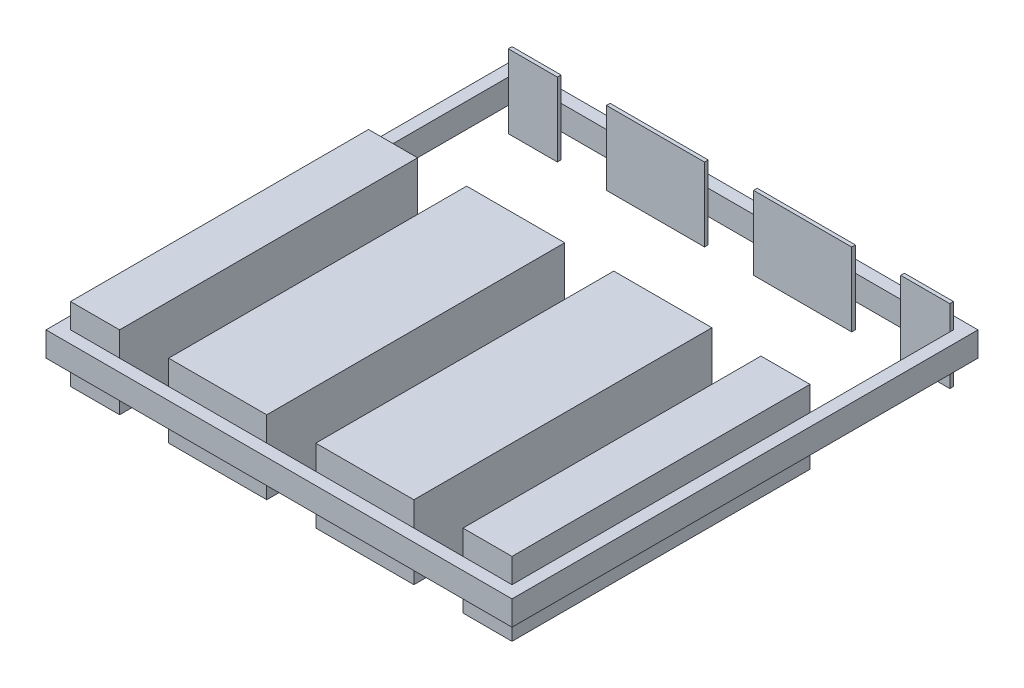
from build123d import *

# Parameters (mm, degrees)
SKETCH1_W           = 180
SKETCH1_H           = 30
BOSS_EXTRUDE1_DEPTH = 90
SKETCH2_W           = 20
SKETCH2_H           = 30
CUT_EXTRUDE1_DEPTH  = 90
CUT_EXTRUDE2_START  = -31.5
SKETCH3_OUTSIDE_W   = 233.264
SKETCH3_OUTSIDE_H   = 83.264
SKETCH3_OUTSIDE_W_2 = 17
SKETCH3_OUTSIDE_H_2 = 27
CUT_EXTRUDE2_DEPTH  = 57
SKETCH4_W           = 17
SKETCH4_H           = 27
CUT_EXTRUDE3_DEPTH  = 28.5
CUT_EXTRUDE4_START  = 31.5
SKETCH5_W           = 17
SKETCH5_H           = 27
CUT_EXTRUDE4_DEPTH  = 57
BOSS_EXTRUDE2_START = -31.5
SKETCH6_W           = 1.5
SKETCH6_H           = 25
BOSS_EXTRUDE2_DEPTH = 57
SKETCH7_W           = 1.5
SKETCH7_H           = 25
BOSS_EXTRUDE3_DEPTH = 28.5
BOSS_EXTRUDE4_START = 31.5
SKETCH8_W           = 1.5
SKETCH8_H           = 25
BOSS_EXTRUDE4_DEPTH = 57
CUT_EXTRUDE5_START  = -31.5
SKETCH9_OUTSIDE_W   = 233.264
SKETCH9_OUTSIDE_H   = 83.264
SKETCH9_OUTSIDE_W_2 = 1.5
SKETCH9_OUTSIDE_H_2 = 2
SKETCH9_OUTSIDE_H_3 = 1
SKETCH9_OUTSIDE_H_4 = 0.5
SKETCH9_OUTSIDE_H_5 = 0.25
CUT_EXTRUDE5_DEPTH  = 57
SKETCH10_W          = 1.5
SKETCH10_H          = 2
SKETCH10_H_2        = 1
SKETCH10_H_3        = 0.5
SKETCH10_H_4        = 0.25
CUT_EXTRUDE6_DEPTH  = 28.5
CUT_EXTRUDE7_START  = 31.5
SKETCH11_W          = 1.5
SKETCH11_H          = 2
SKETCH11_H_2        = 1
SKETCH11_H_3        = 0.5
SKETCH11_H_4        = 0.25
CUT_EXTRUDE7_DEPTH  = 57
SKETCH12_W          = 190
SKETCH12_H          = 190
SKETCH12_W_2        = 180
SKETCH12_H_2        = 180
BOSS_EXTRUDE5_DEPTH = 5


with BuildPart() as part:
    # Sketch1 → Boss-Extrude1 (new, symmetric)
    with BuildSketch(Plane.XY):
        Rectangle(SKETCH1_W, SKETCH1_H)
    extrude(amount=BOSS_EXTRUDE1_DEPTH, both=True)

    # Sketch2 → Cut-Extrude1 (cut, symmetric)
    with BuildSketch(Plane.XY):
        with Locations((-60, 0)):
            Rectangle(SKETCH2_W, SKETCH2_H)
        Rectangle(SKETCH2_W, SKETCH2_H)
        with Locations((60, 0)):
            Rectangle(SKETCH2_W, SKETCH2_H)
    extrude(amount=CUT_EXTRUDE1_DEPTH, both=True, mode=Mode.SUBTRACT)


with BuildPart() as cut_extrude1_piece_1:
    # of the separate pieces the step leaves, piece 1, a body of its own (cut_extrude1_pieces)
    add(part.part.solids().sort_by_distance((-50, -15, -90))[0])


with BuildPart() as cut_extrude1_piece_2:
    # of the separate pieces the step leaves, piece 2, a body of its own (cut_extrude1_pieces)
    add(part.part.solids().sort_by_distance((10, -15, -90))[0])


with BuildPart() as cut_extrude1_piece_3:
    # of the separate pieces the step leaves, piece 3, a body of its own (cut_extrude1_pieces)
    add(part.part.solids().sort_by_distance((-90, -15, 90))[0])


with BuildPart() as cut_extrude1_piece_4:
    # of the separate pieces the step leaves, piece 4, a body of its own (cut_extrude1_pieces)
    add(part.part.solids().sort_by_distance((70, -15, -90))[0])


with BuildPart() as cut_extrude2_tool:
    # Sketch3 outside → Cut-Extrude2 (new body)
    with BuildSketch(Plane.XY.offset(CUT_EXTRUDE2_START)):
        Rectangle(SKETCH3_OUTSIDE_W, SKETCH3_OUTSIDE_H)
        with Locations((-80, 0)):
            Rectangle(SKETCH3_OUTSIDE_W_2, SKETCH3_OUTSIDE_H_2, mode=Mode.SUBTRACT)
        with Locations((-40, 0)):
            Rectangle(SKETCH3_OUTSIDE_W_2, SKETCH3_OUTSIDE_H_2, mode=Mode.SUBTRACT)
        with Locations((-20, 0)):
            Rectangle(SKETCH3_OUTSIDE_W_2, SKETCH3_OUTSIDE_H_2, mode=Mode.SUBTRACT)
        with Locations((20, 0)):
            Rectangle(SKETCH3_OUTSIDE_W_2, SKETCH3_OUTSIDE_H_2, mode=Mode.SUBTRACT)
        with Locations((40, 0)):
            Rectangle(SKETCH3_OUTSIDE_W_2, SKETCH3_OUTSIDE_H_2, mode=Mode.SUBTRACT)
        with Locations((80, 0)):
            Rectangle(SKETCH3_OUTSIDE_W_2, SKETCH3_OUTSIDE_H_2, mode=Mode.SUBTRACT)
    extrude(amount=-CUT_EXTRUDE2_DEPTH)


with BuildPart() as cut_extrude1_piece_1_1:
    add(cut_extrude1_piece_1.part)

    # Cut-Extrude2: cut by cut_extrude2_tool
    add(cut_extrude2_tool.part, mode=Mode.SUBTRACT)


with BuildPart() as cut_extrude1_piece_2_1:
    add(cut_extrude1_piece_2.part)

    # Cut-Extrude2: cut by cut_extrude2_tool
    add(cut_extrude2_tool.part, mode=Mode.SUBTRACT)


with BuildPart() as cut_extrude1_piece_3_1:
    add(cut_extrude1_piece_3.part)

    # Cut-Extrude2: cut by cut_extrude2_tool
    add(cut_extrude2_tool.part, mode=Mode.SUBTRACT)


with BuildPart() as cut_extrude1_piece_4_1:
    add(cut_extrude1_piece_4.part)

    # Cut-Extrude2: cut by cut_extrude2_tool
    add(cut_extrude2_tool.part, mode=Mode.SUBTRACT)


with BuildPart() as cut_extrude3_tool:
    # Sketch4 → Cut-Extrude3 (new, symmetric)
    with BuildSketch(Plane.XY):
        with Locations((-80, 0)):
            Rectangle(SKETCH4_W, SKETCH4_H)
        with Locations((-40, 0)):
            Rectangle(SKETCH4_W, SKETCH4_H)
        with Locations((-20, 0)):
            Rectangle(SKETCH4_W, SKETCH4_H)
        with Locations((20, 0)):
            Rectangle(SKETCH4_W, SKETCH4_H)
        with Locations((40, 0)):
            Rectangle(SKETCH4_W, SKETCH4_H)
        with Locations((80, 0)):
            Rectangle(SKETCH4_W, SKETCH4_H)
    extrude(amount=CUT_EXTRUDE3_DEPTH, both=True)


with BuildPart() as cut_extrude1_piece_1_2:
    add(cut_extrude1_piece_1_1.part)

    # Cut-Extrude3: cut by cut_extrude3_tool
    add(cut_extrude3_tool.part, mode=Mode.SUBTRACT)


with BuildPart() as cut_extrude1_piece_2_2:
    add(cut_extrude1_piece_2_1.part)

    # Cut-Extrude3: cut by cut_extrude3_tool
    add(cut_extrude3_tool.part, mode=Mode.SUBTRACT)


with BuildPart() as cut_extrude1_piece_3_2:
    add(cut_extrude1_piece_3_1.part)

    # Cut-Extrude3: cut by cut_extrude3_tool
    add(cut_extrude3_tool.part, mode=Mode.SUBTRACT)


with BuildPart() as cut_extrude1_piece_4_2:
    add(cut_extrude1_piece_4_1.part)

    # Cut-Extrude3: cut by cut_extrude3_tool
    add(cut_extrude3_tool.part, mode=Mode.SUBTRACT)


with BuildPart() as cut_extrude4_tool:
    # Sketch5 → Cut-Extrude4 (new body)
    with BuildSketch(Plane.XY.offset(CUT_EXTRUDE4_START)):
        with Locations((-80, 0)):
            Rectangle(SKETCH5_W, SKETCH5_H)
        with Locations((-40, 0)):
            Rectangle(SKETCH5_W, SKETCH5_H)
        with Locations((-20, 0)):
            Rectangle(SKETCH5_W, SKETCH5_H)
        with Locations((20, 0)):
            Rectangle(SKETCH5_W, SKETCH5_H)
        with Locations((40, 0)):
            Rectangle(SKETCH5_W, SKETCH5_H)
        with Locations((80, 0)):
            Rectangle(SKETCH5_W, SKETCH5_H)
    extrude(amount=-CUT_EXTRUDE4_DEPTH)


with BuildPart() as cut_extrude1_piece_1_3:
    add(cut_extrude1_piece_1_2.part)

    # Cut-Extrude4: cut by cut_extrude4_tool
    add(cut_extrude4_tool.part, mode=Mode.SUBTRACT)



with BuildPart() as cut_extrude1_piece_2_3:
    add(cut_extrude1_piece_2_2.part)

    # Cut-Extrude4: cut by cut_extrude4_tool
    add(cut_extrude4_tool.part, mode=Mode.SUBTRACT)


with BuildPart() as cut_extrude1_piece_3_3:
    add(cut_extrude1_piece_3_2.part)

    # Cut-Extrude4: cut by cut_extrude4_tool
    add(cut_extrude4_tool.part, mode=Mode.SUBTRACT)


with BuildPart() as cut_extrude1_piece_4_3:
    add(cut_extrude1_piece_4_2.part)

    # Cut-Extrude4: cut by cut_extrude4_tool
    add(cut_extrude4_tool.part, mode=Mode.SUBTRACT)


with BuildPart() as cut_extrude1_piece_1_4:
    add(cut_extrude1_piece_1_3.part)

    add(cut_extrude1_piece_2_3.part)  # Boss-Extrude2 merges Cut-Extrude1 piece 2

    add(cut_extrude1_piece_3_3.part)  # Boss-Extrude2 merges Cut-Extrude1 piece 3

    add(cut_extrude1_piece_4_3.part)  # Boss-Extrude2 merges Cut-Extrude1 piece 4
    # Sketch6 → Boss-Extrude2 (add)
    with BuildSketch(Plane.XY.offset(BOSS_EXTRUDE2_START)):
        with Locations((-75.375, -1)):
            Rectangle(SKETCH6_W, SKETCH6_H)
        with Locations((-80, 1)):
            Rectangle(SKETCH6_W, SKETCH6_H)
        with Locations((-84.625, -1)):
            Rectangle(SKETCH6_W, SKETCH6_H)
        with Locations((-44.625, -1)):
            Rectangle(SKETCH6_W, SKETCH6_H)
        with Locations((-40, 1)):
            Rectangle(SKETCH6_W, SKETCH6_H)
        with Locations((-35.375, -1)):
            Rectangle(SKETCH6_W, SKETCH6_H)
        with Locations((-15.375, -1)):
            Rectangle(SKETCH6_W, SKETCH6_H)
        with Locations((-20, 1)):
            Rectangle(SKETCH6_W, SKETCH6_H)
        with Locations((-24.625, -1)):
            Rectangle(SKETCH6_W, SKETCH6_H)
        with Locations((15.375, -1)):
            Rectangle(SKETCH6_W, SKETCH6_H)
        with Locations((20, 1)):
            Rectangle(SKETCH6_W, SKETCH6_H)
        with Locations((24.625, -1)):
            Rectangle(SKETCH6_W, SKETCH6_H)
        with Locations((44.625, -1)):
            Rectangle(SKETCH6_W, SKETCH6_H)
        with Locations((40, 1)):
            Rectangle(SKETCH6_W, SKETCH6_H)
        with Locations((35.375, -1)):
            Rectangle(SKETCH6_W, SKETCH6_H)
        with Locations((75.375, -1)):
            Rectangle(SKETCH6_W, SKETCH6_H)
        with Locations((80, 1)):
            Rectangle(SKETCH6_W, SKETCH6_H)
        with Locations((84.625, -1)):
            Rectangle(SKETCH6_W, SKETCH6_H)
    extrude(amount=BOSS_EXTRUDE2_DEPTH)

    # Sketch7 → Boss-Extrude3 (add, symmetric)
    with BuildSketch(Plane.XY):
        with Locations((-75.375, -1)):
            Rectangle(SKETCH7_W, SKETCH7_H)
        with Locations((-80, 1)):
            Rectangle(SKETCH7_W, SKETCH7_H)
        with Locations((-84.625, -1)):
            Rectangle(SKETCH7_W, SKETCH7_H)
        with Locations((-44.625, -1)):
            Rectangle(SKETCH7_W, SKETCH7_H)
        with Locations((-40, 1)):
            Rectangle(SKETCH7_W, SKETCH7_H)
        with Locations((-35.375, -1)):
            Rectangle(SKETCH7_W, SKETCH7_H)
        with Locations((-15.375, -1)):
            Rectangle(SKETCH7_W, SKETCH7_H)
        with Locations((-20, 1)):
            Rectangle(SKETCH7_W, SKETCH7_H)
        with Locations((-24.625, -1)):
            Rectangle(SKETCH7_W, SKETCH7_H)
        with Locations((15.375, -1)):
            Rectangle(SKETCH7_W, SKETCH7_H)
        with Locations((20, 1)):
            Rectangle(SKETCH7_W, SKETCH7_H)
        with Locations((24.625, -1)):
            Rectangle(SKETCH7_W, SKETCH7_H)
        with Locations((44.625, -1)):
            Rectangle(SKETCH7_W, SKETCH7_H)
        with Locations((40, 1)):
            Rectangle(SKETCH7_W, SKETCH7_H)
        with Locations((35.375, -1)):
            Rectangle(SKETCH7_W, SKETCH7_H)
        with Locations((75.375, -1)):
            Rectangle(SKETCH7_W, SKETCH7_H)
        with Locations((80, 1)):
            Rectangle(SKETCH7_W, SKETCH7_H)
        with Locations((84.625, -1)):
            Rectangle(SKETCH7_W, SKETCH7_H)
    extrude(amount=BOSS_EXTRUDE3_DEPTH, both=True)

    # Sketch8 → Boss-Extrude4 (add)
    with BuildSketch(Plane.XY.offset(BOSS_EXTRUDE4_START)):
        with Locations((-75.375, -1)):
            Rectangle(SKETCH8_W, SKETCH8_H)
        with Locations((-80, 1)):
            Rectangle(SKETCH8_W, SKETCH8_H)
        with Locations((-84.625, -1)):
            Rectangle(SKETCH8_W, SKETCH8_H)
        with Locations((-44.625, -1)):
            Rectangle(SKETCH8_W, SKETCH8_H)
        with Locations((-40, 1)):
            Rectangle(SKETCH8_W, SKETCH8_H)
        with Locations((-35.375, -1)):
            Rectangle(SKETCH8_W, SKETCH8_H)
        with Locations((-15.375, -1)):
            Rectangle(SKETCH8_W, SKETCH8_H)
        with Locations((-20, 1)):
            Rectangle(SKETCH8_W, SKETCH8_H)
        with Locations((-24.625, -1)):
            Rectangle(SKETCH8_W, SKETCH8_H)
        with Locations((15.375, -1)):
            Rectangle(SKETCH8_W, SKETCH8_H)
        with Locations((20, 1)):
            Rectangle(SKETCH8_W, SKETCH8_H)
        with Locations((24.625, -1)):
            Rectangle(SKETCH8_W, SKETCH8_H)
        with Locations((44.625, -1)):
            Rectangle(SKETCH8_W, SKETCH8_H)
        with Locations((40, 1)):
            Rectangle(SKETCH8_W, SKETCH8_H)
        with Locations((35.375, -1)):
            Rectangle(SKETCH8_W, SKETCH8_H)
        with Locations((75.375, -1)):
            Rectangle(SKETCH8_W, SKETCH8_H)
        with Locations((80, 1)):
            Rectangle(SKETCH8_W, SKETCH8_H)
        with Locations((84.625, -1)):
            Rectangle(SKETCH8_W, SKETCH8_H)
    extrude(amount=BOSS_EXTRUDE4_DEPTH)

    # Sketch9 outside → Cut-Extrude5 (cut)
    with BuildSketch(Plane.XY.offset(CUT_EXTRUDE5_START)):
        Rectangle(SKETCH9_OUTSIDE_W, SKETCH9_OUTSIDE_H)
        with Locations((-70.75, -12.5)):
            Rectangle(SKETCH9_OUTSIDE_W_2, SKETCH9_OUTSIDE_H_2, mode=Mode.SUBTRACT)
        with Locations((-10.75, -13)):
            Rectangle(SKETCH9_OUTSIDE_W_2, SKETCH9_OUTSIDE_H_3, mode=Mode.SUBTRACT)
        with Locations((10.75, -12.75)):
            Rectangle(SKETCH9_OUTSIDE_W_2, SKETCH9_OUTSIDE_H_4, mode=Mode.SUBTRACT)
        with Locations((49.25, -12.625)):
            Rectangle(SKETCH9_OUTSIDE_W_2, SKETCH9_OUTSIDE_H_5, mode=Mode.SUBTRACT)
    extrude(amount=-CUT_EXTRUDE5_DEPTH, mode=Mode.SUBTRACT)

    # Sketch10 → Cut-Extrude6 (cut, symmetric)
    with BuildSketch(Plane.XY):
        with Locations((-70.75, -12.5)):
            Rectangle(SKETCH10_W, SKETCH10_H)
        with Locations((-10.75, -13)):
            Rectangle(SKETCH10_W, SKETCH10_H_2)
        with Locations((10.75, -12.75)):
            Rectangle(SKETCH10_W, SKETCH10_H_3)
        with Locations((49.25, -12.625)):
            Rectangle(SKETCH10_W, SKETCH10_H_4)
    extrude(amount=CUT_EXTRUDE6_DEPTH, both=True, mode=Mode.SUBTRACT)

    # Sketch11 → Cut-Extrude7 (cut)
    with BuildSketch(Plane.XY.offset(CUT_EXTRUDE7_START)):
        with Locations((-70.75, -12.5)):
            Rectangle(SKETCH11_W, SKETCH11_H)
        with Locations((-10.75, -13)):
            Rectangle(SKETCH11_W, SKETCH11_H_2)
        with Locations((10.75, -12.75)):
            Rectangle(SKETCH11_W, SKETCH11_H_3)
        with Locations((49.25, -12.625)):
            Rectangle(SKETCH11_W, SKETCH11_H_4)
    extrude(amount=-CUT_EXTRUDE7_DEPTH, mode=Mode.SUBTRACT)

    # Sketch12 → Boss-Extrude5 (add, symmetric)
    with BuildSketch(Plane(origin=(0, 0, 0), x_dir=(1, 0, 0), z_dir=(0, 1, 0))):
        Rectangle(SKETCH12_W, SKETCH12_H)
        Rectangle(SKETCH12_W_2, SKETCH12_H_2, mode=Mode.SUBTRACT)
    extrude(amount=BOSS_EXTRUDE5_DEPTH, both=True)


solid = cut_extrude1_piece_1_4.part
